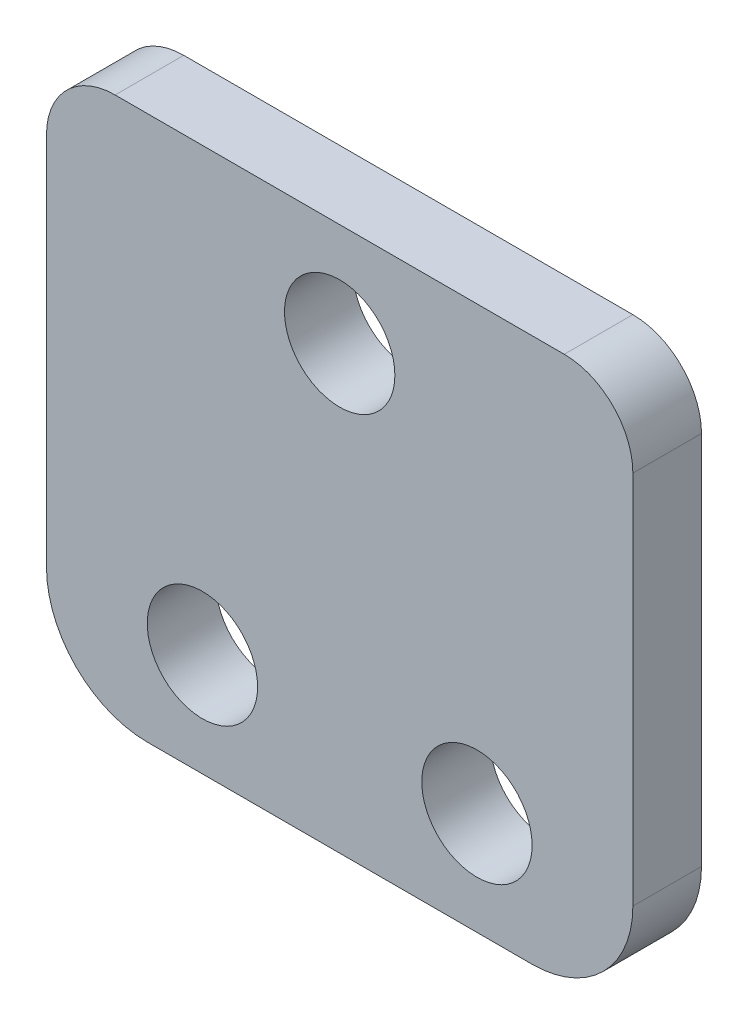
from build123d import *

# Parameters (mm, degrees)
BOSS_EXTRUDE1_DEPTH    = 3.175
F_10_CLEARANCE_HOLE1_D = 5.1054


with BuildPart() as part:
    # Sketch1 → Boss-Extrude1 (new body)
    with BuildSketch(Plane.XY):
        with BuildLine():
            ThreePointArc((8.9027, -4.6609), (12.198454, -3.295753993), (13.5636, 1e-08))
            Line((13.5636, 1e-08), (13.5636, 17.3482))
            ThreePointArc((13.5636, 17.3482), (12.63366403, 19.59326403), (10.3886, 20.5232))
            Line((10.3886, 20.5232), (-10.3886, 20.5232))
            ThreePointArc((-10.3886, 20.5232), (-12.63366403, 19.59326403), (-13.5636, 17.3482))
            Line((-13.5636, 17.3482), (-13.5636, -1.9e-08))
            ThreePointArc((-13.5636, -1.9e-08), (-12.19845399, -3.295754003), (-8.9027, -4.6609))
            Line((-8.9027, -4.6609), (8.9027, -4.6609))
        make_face()
    extrude(amount=BOSS_EXTRUDE1_DEPTH)

    # #10 Clearance Hole1 (through all)
    with Locations(Plane.XY.offset(3.175)):
        with Locations((6.35, 0.1016), (-6.35, 0.1016), (0, 15.7607)):
            Hole(F_10_CLEARANCE_HOLE1_D / 2)


solid = part.part
